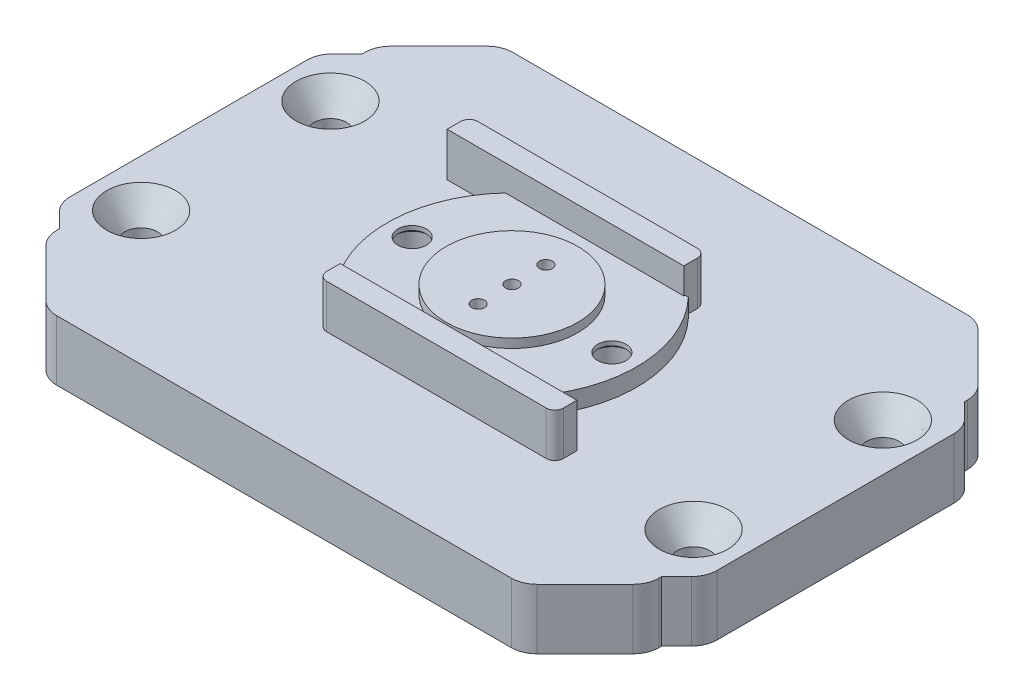
from build123d import *
from OCP.BRepFilletAPI import BRepFilletAPI_MakeChamfer

# Parameters (mm, degrees)
SKETCH1_R           = 7.65
SKETCH1_R_2         = 0.75
BOSS_EXTRUDE1_DEPTH = 3.103
SKETCH1_3_R         = 2.1
SKETCH1_3_R_2       = 7.65
BOSS_EXTRUDE2_DEPTH = 2.06
SKETCH2_W           = 27.509
SKETCH2_H           = 2.566
BOSS_EXTRUDE3_DEPTH = 5.084
BOSS_EXTRUDE4_START = 0.4
SKETCH3_R           = 1.9
SKETCH3_R_2         = 2.1
SKETCH3_R_3         = 0.75
BOSS_EXTRUDE4_DEPTH = 0.4
BOSS_EXTRUDE5_START = 3.6
SKETCH3_3_R         = 1.9
SKETCH3_3_R_2       = 2.1
SKETCH3_3_R_3       = 6.404
BOSS_EXTRUDE5_DEPTH = 3.6
BOSS_EXTRUDE6_START = 7
SKETCH3_4_R         = 1.9
BOSS_EXTRUDE6_DEPTH = 7
FILLET1_R           = 1
CHAMFER1_SIZE       = 3.1
CHAMFER1_SIZE2      = 2.1
BOSS_EXTRUDE7_START = 0.5
SKETCH4_R           = 6.404
SKETCH4_R_2         = 1
BOSS_EXTRUDE7_DEPTH = 0.5
BOSS_EXTRUDE8_START = 0.3
BOSS_EXTRUDE8_DEPTH = 0.3
SKETCH6_R           = 2.125
SKETCH6_R_2         = 1.65
BOSS_EXTRUDE9_DEPTH = 0.5
CHAMFER2_SIZE       = 0.4


with BuildPart() as part:
    # Sketch1 → Boss-Extrude1 (new body)
    with BuildSketch(Plane(origin=(0, 0, 0), x_dir=(1, 0, 0), z_dir=(0, 1, 0))):
        Circle(SKETCH1_R)
        with Locations((0, -3.937)):
            Circle(SKETCH1_R_2, mode=Mode.SUBTRACT)
        Circle(SKETCH1_R_2, mode=Mode.SUBTRACT)
        with Locations((0, 3.937)):
            Circle(SKETCH1_R_2, mode=Mode.SUBTRACT)
    extrude(amount=BOSS_EXTRUDE1_DEPTH)

    # Sketch1<3> → Boss-Extrude2 (add)
    with BuildSketch(Plane(origin=(0, 0, 0), x_dir=(1, 0, 0), z_dir=(0, 1, 0))):
        with BuildLine():
            ThreePointArc((-10.5, 10), (-14.5, 0), (-10.5, -10))
            Line((-10.5, -10), (10.5, -10))
            ThreePointArc((10.5, -10), (14.5, 0), (10.5, 10))
            Line((10.5, 10), (-10.5, 10))
        make_face()
        with Locations((-11.608, 0)):
            Circle(SKETCH1_3_R, mode=Mode.SUBTRACT)
        with Locations((11.608, 0)):
            Circle(SKETCH1_3_R, mode=Mode.SUBTRACT)
        Circle(SKETCH1_3_R_2, mode=Mode.SUBTRACT)
    extrude(amount=BOSS_EXTRUDE2_DEPTH)

    # Sketch2 → Boss-Extrude3 (add)
    with BuildSketch(Plane.XZ):
        with Locations((3.654588862, 11.149)):
            Rectangle(SKETCH2_W, SKETCH2_H)
        with Locations((-3.654588862, -11.149)):
            Rectangle(SKETCH2_W, SKETCH2_H)
    extrude(amount=-BOSS_EXTRUDE3_DEPTH)

    # Sketch3 → Boss-Extrude4 (add)
    with BuildSketch(Plane.XZ.offset(BOSS_EXTRUDE4_START)):
        with BuildLine():
            ThreePointArc((36.721320344, -15.878679656), (37.371638598, -14.90540961), (37.6, -13.757359313))
            Line((37.6, -13.757359313), (37.6, 13.757359313))
            ThreePointArc((37.6, 13.757359313), (37.371638598, 14.90540961), (36.721320344, 15.878679656))
            Line((36.721320344, 15.878679656), (35, 17.6))
            Line((35, 17.6), (35, 17.914213562))
            ThreePointArc((35, 17.914213562), (34.771638598, 19.062263859), (34.121320344, 20.035533906))
            Line((34.121320344, 20.035533906), (28.535533906, 25.621320344))
            ThreePointArc((28.535533906, 25.621320344), (27.562263859, 26.271638598), (26.414213562, 26.5))
            Line((26.414213562, 26.5), (-26.414213562, 26.5))
            ThreePointArc((-26.414213562, 26.5), (-27.562263859, 26.271638598), (-28.535533906, 25.621320344))
            Line((-28.535533906, 25.621320344), (-34.121320344, 20.035533906))
            ThreePointArc((-34.121320344, 20.035533906), (-34.771638598, 19.062263859), (-35, 17.914213562))
            Line((-35, 17.914213562), (-35, 17.6))
            Line((-35, 17.6), (-36.721320344, 15.878679656))
            ThreePointArc((-36.721320344, 15.878679656), (-37.371638598, 14.90540961), (-37.6, 13.757359313))
            Line((-37.6, 13.757359313), (-37.6, -13.757359313))
            ThreePointArc((-37.6, -13.757359313), (-37.371638598, -14.90540961), (-36.721320344, -15.878679656))
            Line((-36.721320344, -15.878679656), (-35, -17.6))
            Line((-35, -17.6), (-35, -17.914213562))
            ThreePointArc((-35, -17.914213562), (-34.771638598, -19.062263859), (-34.121320344, -20.035533906))
            Line((-34.121320344, -20.035533906), (-28.535533906, -25.621320344))
            ThreePointArc((-28.535533906, -25.621320344), (-27.562263859, -26.271638598), (-26.414213562, -26.5))
            Line((-26.414213562, -26.5), (26.414213562, -26.5))
            ThreePointArc((26.414213562, -26.5), (27.562263859, -26.271638598), (28.535533906, -25.621320344))
            Line((28.535533906, -25.621320344), (34.121320344, -20.035533906))
            ThreePointArc((34.121320344, -20.035533906), (34.771638598, -19.062263859), (35, -17.914213562))
            Line((35, -17.914213562), (35, -17.6))
            Line((35, -17.6), (36.721320344, -15.878679656))
        make_face()
        with Locations((-32.1, -11)):
            Circle(SKETCH3_R, mode=Mode.SUBTRACT)
        with Locations((32.1, 11)):
            Circle(SKETCH3_R, mode=Mode.SUBTRACT)
        with Locations((32.1, -11)):
            Circle(SKETCH3_R, mode=Mode.SUBTRACT)
        with Locations((-32.1, 11)):
            Circle(SKETCH3_R, mode=Mode.SUBTRACT)
        with Locations((-11.608, 0)):
            Circle(SKETCH3_R_2, mode=Mode.SUBTRACT)
        with Locations((11.608, 0)):
            Circle(SKETCH3_R_2, mode=Mode.SUBTRACT)
        with Locations((0, 3.937)):
            Circle(SKETCH3_R_3, mode=Mode.SUBTRACT)
        with Locations((0, -3.937)):
            Circle(SKETCH3_R_3, mode=Mode.SUBTRACT)
        Circle(SKETCH3_R_3, mode=Mode.SUBTRACT)
    extrude(amount=-BOSS_EXTRUDE4_DEPTH)

    # Sketch3<3> → Boss-Extrude5 (add)
    with BuildSketch(Plane.XZ.offset(BOSS_EXTRUDE5_START)):
        with BuildLine():
            ThreePointArc((36.721320344, -15.878679656), (37.371638598, -14.90540961), (37.6, -13.757359313))
            Line((37.6, -13.757359313), (37.6, 13.757359313))
            ThreePointArc((37.6, 13.757359313), (37.371638598, 14.90540961), (36.721320344, 15.878679656))
            Line((36.721320344, 15.878679656), (35, 17.6))
            Line((35, 17.6), (35, 17.914213562))
            ThreePointArc((35, 17.914213562), (34.771638598, 19.062263859), (34.121320344, 20.035533906))
            Line((34.121320344, 20.035533906), (28.535533906, 25.621320344))
            ThreePointArc((28.535533906, 25.621320344), (27.562263859, 26.271638598), (26.414213562, 26.5))
            Line((26.414213562, 26.5), (-26.414213562, 26.5))
            ThreePointArc((-26.414213562, 26.5), (-27.562263859, 26.271638598), (-28.535533906, 25.621320344))
            Line((-28.535533906, 25.621320344), (-34.121320344, 20.035533906))
            ThreePointArc((-34.121320344, 20.035533906), (-34.771638598, 19.062263859), (-35, 17.914213562))
            Line((-35, 17.914213562), (-35, 17.6))
            Line((-35, 17.6), (-36.721320344, 15.878679656))
            ThreePointArc((-36.721320344, 15.878679656), (-37.371638598, 14.90540961), (-37.6, 13.757359313))
            Line((-37.6, 13.757359313), (-37.6, -13.757359313))
            ThreePointArc((-37.6, -13.757359313), (-37.371638598, -14.90540961), (-36.721320344, -15.878679656))
            Line((-36.721320344, -15.878679656), (-35, -17.6))
            Line((-35, -17.6), (-35, -17.914213562))
            ThreePointArc((-35, -17.914213562), (-34.771638598, -19.062263859), (-34.121320344, -20.035533906))
            Line((-34.121320344, -20.035533906), (-28.535533906, -25.621320344))
            ThreePointArc((-28.535533906, -25.621320344), (-27.562263859, -26.271638598), (-26.414213562, -26.5))
            Line((-26.414213562, -26.5), (26.414213562, -26.5))
            ThreePointArc((26.414213562, -26.5), (27.562263859, -26.271638598), (28.535533906, -25.621320344))
            Line((28.535533906, -25.621320344), (34.121320344, -20.035533906))
            ThreePointArc((34.121320344, -20.035533906), (34.771638598, -19.062263859), (35, -17.914213562))
            Line((35, -17.914213562), (35, -17.6))
            Line((35, -17.6), (36.721320344, -15.878679656))
        make_face()
        with Locations((-32.1, -11)):
            Circle(SKETCH3_3_R, mode=Mode.SUBTRACT)
        with Locations((32.1, 11)):
            Circle(SKETCH3_3_R, mode=Mode.SUBTRACT)
        with Locations((32.1, -11)):
            Circle(SKETCH3_3_R, mode=Mode.SUBTRACT)
        with Locations((-32.1, 11)):
            Circle(SKETCH3_3_R, mode=Mode.SUBTRACT)
        with Locations((-11.608, 0)):
            Circle(SKETCH3_3_R_2, mode=Mode.SUBTRACT)
        Circle(SKETCH3_3_R_3, mode=Mode.SUBTRACT)
        with Locations((11.608, 0)):
            Circle(SKETCH3_3_R_2, mode=Mode.SUBTRACT)
    extrude(amount=-BOSS_EXTRUDE5_DEPTH)

    # Sketch3<4> → Boss-Extrude6 (add)
    with BuildSketch(Plane.XZ.offset(BOSS_EXTRUDE6_START)):
        with BuildLine():
            ThreePointArc((36.721320344, -15.878679656), (37.371638598, -14.90540961), (37.6, -13.757359313))
            Line((37.6, -13.757359313), (37.6, 13.757359313))
            ThreePointArc((37.6, 13.757359313), (37.371638598, 14.90540961), (36.721320344, 15.878679656))
            Line((36.721320344, 15.878679656), (35, 17.6))
            Line((35, 17.6), (35, 17.914213562))
            ThreePointArc((35, 17.914213562), (34.771638598, 19.062263859), (34.121320344, 20.035533906))
            Line((34.121320344, 20.035533906), (28.535533906, 25.621320344))
            ThreePointArc((28.535533906, 25.621320344), (27.562263859, 26.271638598), (26.414213562, 26.5))
            Line((26.414213562, 26.5), (-26.414213562, 26.5))
            ThreePointArc((-26.414213562, 26.5), (-27.562263859, 26.271638598), (-28.535533906, 25.621320344))
            Line((-28.535533906, 25.621320344), (-34.121320344, 20.035533906))
            ThreePointArc((-34.121320344, 20.035533906), (-34.771638598, 19.062263859), (-35, 17.914213562))
            Line((-35, 17.914213562), (-35, 17.6))
            Line((-35, 17.6), (-36.721320344, 15.878679656))
            ThreePointArc((-36.721320344, 15.878679656), (-37.371638598, 14.90540961), (-37.6, 13.757359313))
            Line((-37.6, 13.757359313), (-37.6, -13.757359313))
            ThreePointArc((-37.6, -13.757359313), (-37.371638598, -14.90540961), (-36.721320344, -15.878679656))
            Line((-36.721320344, -15.878679656), (-35, -17.6))
            Line((-35, -17.6), (-35, -17.914213562))
            ThreePointArc((-35, -17.914213562), (-34.771638598, -19.062263859), (-34.121320344, -20.035533906))
            Line((-34.121320344, -20.035533906), (-28.535533906, -25.621320344))
            ThreePointArc((-28.535533906, -25.621320344), (-27.562263859, -26.271638598), (-26.414213562, -26.5))
            Line((-26.414213562, -26.5), (26.414213562, -26.5))
            ThreePointArc((26.414213562, -26.5), (27.562263859, -26.271638598), (28.535533906, -25.621320344))
            Line((28.535533906, -25.621320344), (34.121320344, -20.035533906))
            ThreePointArc((34.121320344, -20.035533906), (34.771638598, -19.062263859), (35, -17.914213562))
            Line((35, -17.914213562), (35, -17.6))
            Line((35, -17.6), (36.721320344, -15.878679656))
        make_face()
        with Locations((-32.1, -11)):
            Circle(SKETCH3_4_R, mode=Mode.SUBTRACT)
        with BuildLine():
            Line((31, -14.845776905), (31, -17.5))
            Line((31, -17.5), (26, -22.5))
            Line((26, -22.5), (-26, -22.5))
            Line((-26, -22.5), (-31, -17.5))
            Line((-31, -17.5), (-31, -14.845776905))
            ThreePointArc((-31, -14.845776905), (-28.1, -11), (-31, -7.154223095))
            Line((-31, -7.154223095), (-31, 7.154223095))
            ThreePointArc((-31, 7.154223095), (-28.1, 11), (-31, 14.845776905))
            Line((-31, 14.845776905), (-31, 17.5))
            Line((-31, 17.5), (-26, 22.5))
            Line((-26, 22.5), (26, 22.5))
            Line((26, 22.5), (31, 17.5))
            Line((31, 17.5), (31, 14.845776905))
            ThreePointArc((31, 14.845776905), (28.1, 11), (31, 7.154223095))
            Line((31, 7.154223095), (31, -7.154223095))
            ThreePointArc((31, -7.154223095), (28.1, -11), (31, -14.845776905))
        make_face(mode=Mode.SUBTRACT)
        with Locations((32.1, -11)):
            Circle(SKETCH3_4_R, mode=Mode.SUBTRACT)
        with Locations((-32.1, 11)):
            Circle(SKETCH3_4_R, mode=Mode.SUBTRACT)
        with Locations((32.1, 11)):
            Circle(SKETCH3_4_R, mode=Mode.SUBTRACT)
    extrude(amount=-BOSS_EXTRUDE6_DEPTH)

    # Fillet1
    fillet1_edges = [part.edges().sort_by_distance(p)[0] for p in [
        (-17.409088862, 2.542, -12.432),
        (10.099911138, 2.542, -12.432),
        (17.409088862, 2.542, 12.432),
        (-10.099911138, 2.542, 12.432),
    ]]
    fillet(fillet1_edges, radius=FILLET1_R)

    # Chamfer1: one chamfer whose edges measure the first distance from different faces: ONE call of the kernel's chamfer builder (chamfer() names one face for all edges)
    chamfer1_edges_1 = [part.edges().sort_by_distance(p)[0] for p in [
        (30.2, 0, -11),
    ]]
    chamfer1_side_1 = [part.faces().sort_by_distance(p)[0] for p in [
        (30.2, -0.2, -11),
    ]]
    chamfer1_edges_2 = [part.edges().sort_by_distance(p)[0] for p in [
        (30.2, 0, 11),
    ]]
    chamfer1_side_2 = [part.faces().sort_by_distance(p)[0] for p in [
        (30.2, -0.2, 11),
    ]]
    chamfer1_edges_3 = [part.edges().sort_by_distance(p)[0] for p in [
        (-34, 0, 11),
    ]]
    chamfer1_side_3 = [part.faces().sort_by_distance(p)[0] for p in [
        (-34, -0.2, 11),
    ]]
    chamfer1_edges_4 = [part.edges().sort_by_distance(p)[0] for p in [
        (-34, 0, -11),
    ]]
    chamfer1_side_4 = [part.faces().sort_by_distance(p)[0] for p in [
        (-34, -0.2, -11),
    ]]
    chamfer1 = BRepFilletAPI_MakeChamfer(part.part.solid().wrapped)
    for e in chamfer1_edges_1:
        chamfer1.Add(CHAMFER1_SIZE, CHAMFER1_SIZE2, e.wrapped, chamfer1_side_1[0].wrapped)  # the first distance lies on this face
    for e in chamfer1_edges_2:
        chamfer1.Add(CHAMFER1_SIZE, CHAMFER1_SIZE2, e.wrapped, chamfer1_side_2[0].wrapped)  # the first distance lies on this face
    for e in chamfer1_edges_3:
        chamfer1.Add(CHAMFER1_SIZE, CHAMFER1_SIZE2, e.wrapped, chamfer1_side_3[0].wrapped)  # the first distance lies on this face
    for e in chamfer1_edges_4:
        chamfer1.Add(CHAMFER1_SIZE, CHAMFER1_SIZE2, e.wrapped, chamfer1_side_4[0].wrapped)  # the first distance lies on this face
    add(Compound.cast(chamfer1.Shape()), mode=Mode.REPLACE)

    # Sketch4 → Boss-Extrude7 (add)
    with BuildSketch(Plane.XZ.offset(0.4).offset(BOSS_EXTRUDE7_START)):
        Circle(SKETCH4_R)
        Circle(SKETCH4_R_2, mode=Mode.SUBTRACT)
        with Locations((0, -3.937)):
            Circle(SKETCH4_R_2, mode=Mode.SUBTRACT)
        with Locations((0, 3.937)):
            Circle(SKETCH4_R_2, mode=Mode.SUBTRACT)
    extrude(amount=-BOSS_EXTRUDE7_DEPTH)

    # Sketch5 → Boss-Extrude8 (add)
    with BuildSketch(Plane.XZ.offset(0.9).offset(BOSS_EXTRUDE8_START)):
        with BuildLine():
            Line((-1, -6.325441961), (-1, 6.325441961))
            ThreePointArc((-1, 6.325441961), (-6.404, 0), (-1, -6.325441961))
        make_face()
        with BuildLine():
            ThreePointArc((1, -6.325441961), (6.404, 0), (1, 6.325441961))
            Line((1, 6.325441961), (1, -6.325441961))
        make_face()
    extrude(amount=-BOSS_EXTRUDE8_DEPTH)

    # Sketch6 → Boss-Extrude9 (add)
    # profile 1 of 2: a face of its own
    with BuildSketch(Plane(origin=(0, 2.06, 0), x_dir=(1, 0, 0), z_dir=(0, 1, 0))):
        with Locations((-11.608, 0)):
            Circle(SKETCH6_R)
        with Locations((-11.608, 0)):
            Circle(SKETCH6_R_2, mode=Mode.SUBTRACT)
    # profile 2 of 2: a face of its own
    with BuildSketch(Plane(origin=(0, 2.06, 0), x_dir=(1, 0, 0), z_dir=(0, 1, 0))):
        with Locations((11.608, 0)):
            Circle(SKETCH6_R)
        with Locations((11.608, 0)):
            Circle(SKETCH6_R_2, mode=Mode.SUBTRACT)
    extrude(amount=-BOSS_EXTRUDE9_DEPTH)

    # Chamfer2
    chamfer2_edges = [part.edges().sort_by_distance(p)[0] for p in [
        (-13.708, 1.56, 0),
        (9.508, 1.56, 0),
    ]]
    chamfer(chamfer2_edges, length=CHAMFER2_SIZE)


solid = part.part
